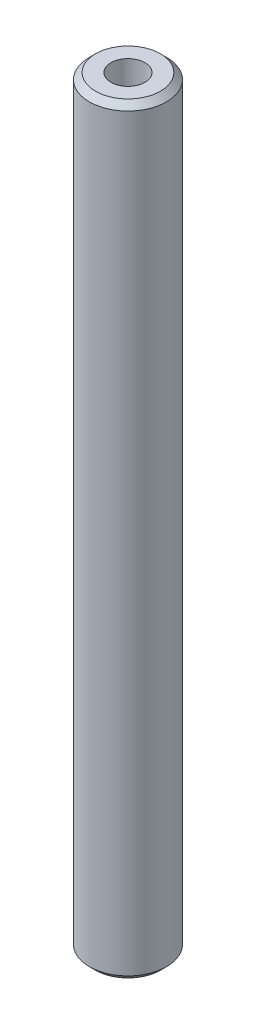
from build123d import *

# Parameters (mm, degrees)
SKETCH1_R           = 5
BOSS_EXTRUDE1_DEPTH = 98.636517694
SKETCH2_R           = 2.207363901
CUT_EXTRUDE1_DEPTH  = 99.889648714
CHAMFER1_SIZE       = 0.795762827


with BuildPart() as part:
    # Sketch1 → Boss-Extrude1 (new body)
    with BuildSketch(Plane(origin=(0, 0, 0), x_dir=(1, 0, 0), z_dir=(0, 1, 0))):
        Circle(SKETCH1_R)
    extrude(amount=BOSS_EXTRUDE1_DEPTH)

    # Sketch2 → Cut-Extrude1 (cut, through all)
    with BuildSketch(Plane(origin=(0, 0, 0), x_dir=(1, 0, 0), z_dir=(0, 1, 0))):
        Circle(SKETCH2_R)
    extrude(amount=CUT_EXTRUDE1_DEPTH, mode=Mode.SUBTRACT)

    # Chamfer1
    chamfer1_edges = [part.edges().sort_by_distance(p)[0] for p in [
        (-5, 98.636517694, 0),
        (-5, 0, 0),
    ]]
    chamfer(chamfer1_edges, length=CHAMFER1_SIZE)


solid = part.part
